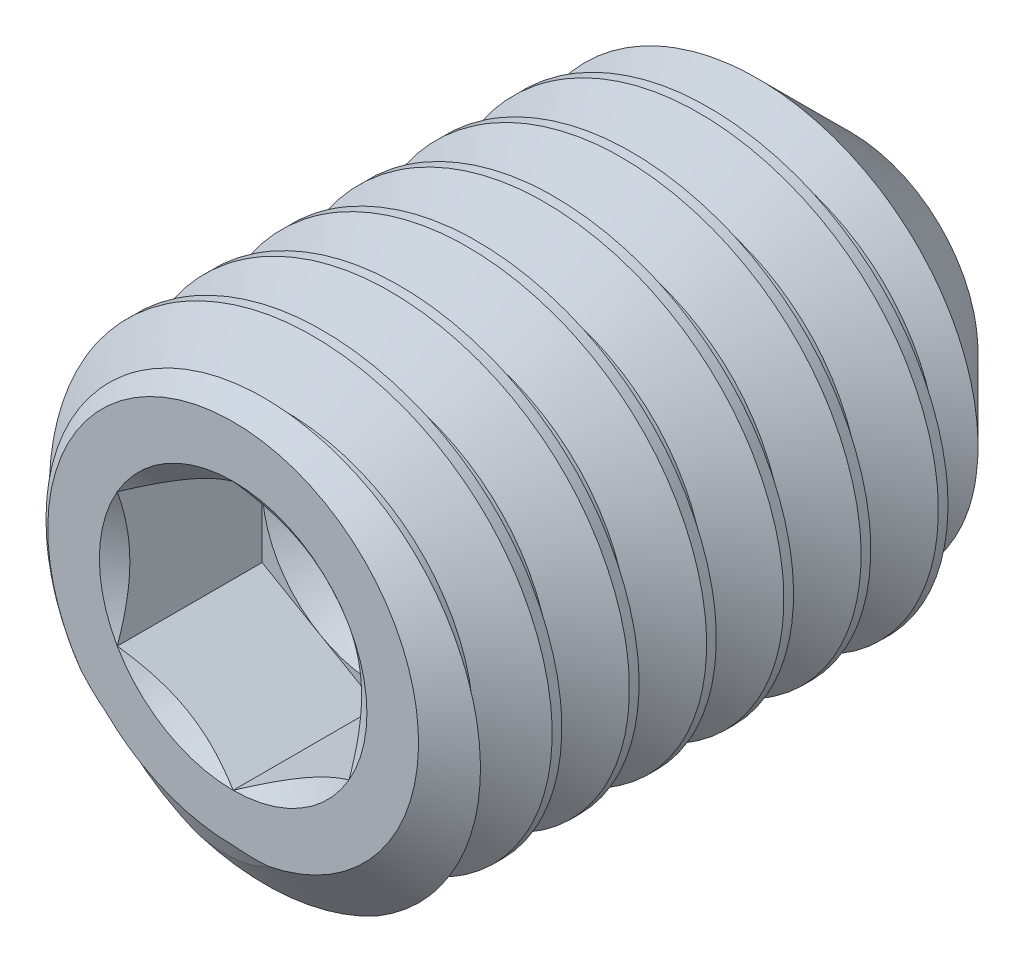
from build123d import *

# Parameters (mm, degrees)
CUT_SWEEP_PITCH   = 0.5
HEX_EXTRUDE_DEPTH = 0.9375


with BuildPart() as part:
    # Body Sketch → Body Revolve (revolve)
    with BuildSketch(Plane(origin=(0, 0, 0), x_dir=(0, 0, -1), z_dir=(1, 0, 0))):
        Polygon((-1.7530621, 0), (-1.7530621, 1.2), (-1.542999839, 1.5), (1.568885259, 1.5), (2.2469379, 0.821947359), (1.7530621, 0), align=None)
    revolve(axis=Axis((0, 0, -1.7530621), (0, 0, 1)))

    # Cut Sweep: the profile of Cut Sweep Sketch profile screwed along a right-hand helix of 9 turns, 6 arcs to a turn; built about Z, then put on its axis
    cut_sweep_z = Axis((0, 0, 0), (0, 0, 1))
    cut_sweep_corners = [(1.5003, 0, 0.000173205), (1.5003, 0, -0.437673205), (1.175240474, 0, -0.25), (1.175240474, 0, -0.1875)]
    with BuildLine(mode=Mode.PRIVATE) as cut_sweep_profile:
        Line(cut_sweep_corners[0], cut_sweep_corners[1])
        Line(cut_sweep_corners[1], cut_sweep_corners[2])
        Line(cut_sweep_corners[2], cut_sweep_corners[3])
        Line(cut_sweep_corners[3], cut_sweep_corners[0])
    cut_sweep_cap = Face(cut_sweep_profile.wire())
    cut_sweep_turn_angles = [0, 30, 60, 90, 120, 150, 180, 210, 240, 270, 300, 330, 360]
    cut_sweep_turn_weights = [1, 0.8660254037844387, 1, 0.8660254037844387, 1, 0.8660254037844387, 1, 0.8660254037844387, 1, 0.8660254037844387, 1, 0.8660254037844387, 1]
    cut_sweep_turn_rails = [Edge.make_bspline([Vector(p[0], p[1], 0).rotate(cut_sweep_z, cut_sweep_turn_angles[k]) / cut_sweep_turn_weights[k] + Vector(0, 0, p[2] + CUT_SWEEP_PITCH * cut_sweep_turn_angles[k] / 360) for k in range(13)], [0, 0, 0, 1, 1, 2, 2, 3, 3, 4, 4, 5, 5, 6, 6, 6], 2, cut_sweep_turn_weights) for p in cut_sweep_corners]
    cut_sweep_turn_sides = [Face.make_surface_from_curves(cut_sweep_turn_rails[p[0]], cut_sweep_turn_rails[p[1]]) for p in [(0, 1), (1, 2), (2, 3), (3, 0)]]
    cut_sweep = Plane(origin=(0, 0, -2.2469379), x_dir=(0, 1, 0), z_dir=(0, 0, 1)) * Solid(Shell([*[p.moved(Location((0, 0, CUT_SWEEP_PITCH * i))) for i in range(9) for p in cut_sweep_turn_sides], cut_sweep_cap, cut_sweep_cap.rotate(cut_sweep_z, 3240).moved(Location((0, 0, CUT_SWEEP_PITCH * 3240 / 360)))]))
    add(cut_sweep, mode=Mode.SUBTRACT)

    # Hex Sketch → Hex Extrude (cut)
    with BuildSketch(Plane.XY.offset(1.7530621)):
        Polygon((0, 0.866025404), (-0.75, 0.433012702), (-0.75, -0.433012702), (0, -0.866025404), (0.75, -0.433012702), (0.75, 0.433012702), align=None)
    extrude(amount=-HEX_EXTRUDE_DEPTH, mode=Mode.SUBTRACT)

    # Hex Entry Extrude cone 1 section (through the dimple's axis) → Hex Entry Extrude (revolve, cut)
    with BuildSketch(Plane(origin=(0, 0, 1.7530621), x_dir=(0, -1, 0), z_dir=(1, 0, 0))):
        Polygon((0, 0), (0.866025404, 0), (0, 0.606397516), align=None)
    revolve(axis=Axis((0, 0, 1.7530621), (0, 0, -1)), mode=Mode.SUBTRACT)

    # Hex Bottom Extrude cone 1 section (through the dimple's axis) → Hex Bottom Extrude (revolve, cut)
    with BuildSketch(Plane(origin=(0, 0, 0.8155621), x_dir=(0, -1, 0), z_dir=(1, 0, 0))):
        Polygon((0, 0), (0.75, 0), (0, 0.433012702), align=None)
    revolve(axis=Axis((0, 0, 0.8155621), (0, 0, -1)), mode=Mode.SUBTRACT)


solid = part.part
